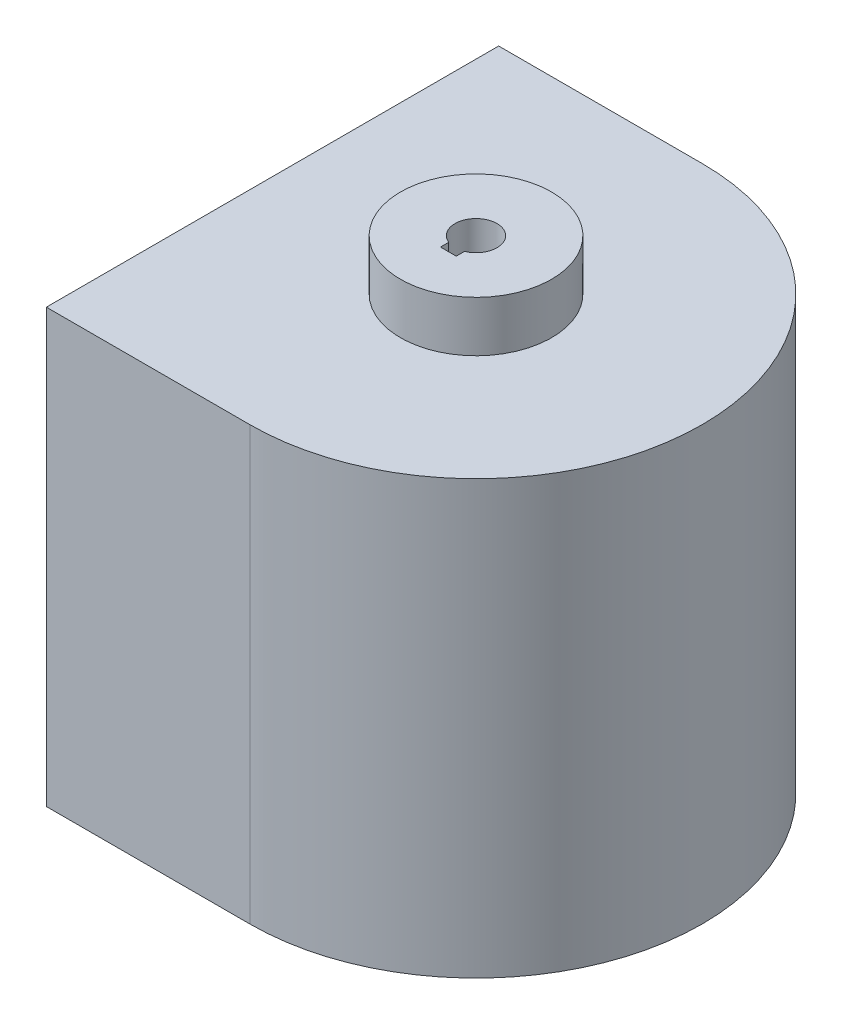
from build123d import *

# Parameters (mm, degrees)
BOSS_EXTRUDE1_DEPTH = 85
SKETCH2_R           = 14.86
BOSS_EXTRUDE2_DEPTH = 9.95
BOSS_EXTRUDE3_START = 9.95
SKETCH3_R           = 14.86
BOSS_EXTRUDE3_DEPTH = 9.95
CUT_EXTRUDE2_DEPTH  = 30


with BuildPart() as part:
    # Sketch1 → Boss-Extrude1 (new body)
    with BuildSketch(Plane(origin=(0, 0, 0), x_dir=(1, 0, 0), z_dir=(0, 1, 0))):
        with BuildLine():
            Line((0, 44.45), (-40, 44.45))
            Line((-40, 44.45), (-40, -44.45))
            Line((-40, -44.45), (0, -44.45))
            ThreePointArc((0, -44.45), (44.45, 0), (0, 44.45))
        make_face()
    extrude(amount=BOSS_EXTRUDE1_DEPTH)

    # Sketch2 → Boss-Extrude2 (add)
    with BuildSketch(Plane(origin=(0, 85, 0), x_dir=(1, 0, 0), z_dir=(0, 1, 0))):
        Circle(SKETCH2_R)
    extrude(amount=BOSS_EXTRUDE2_DEPTH)

    # Sketch3 → Boss-Extrude3 (add)
    with BuildSketch(Plane.XZ.offset(BOSS_EXTRUDE3_START)):
        Circle(SKETCH3_R)
    extrude(amount=-BOSS_EXTRUDE3_DEPTH)

    # Sketch6 → Cut-Extrude2 (cut)
    with BuildSketch(Plane(origin=(0, 94.95, 0), x_dir=(1, 0, 0), z_dir=(0, 1, 0))):
        with BuildLine():
            Line((1.55, -5.44), (1.55, -3.817315811))
            ThreePointArc((1.55, -3.817315811), (0, 4.12), (-1.55, -3.817315811))
            Line((-1.55, -3.817315811), (-1.55, -5.44))
            Line((-1.55, -5.44), (1.55, -5.44))
        make_face()
    extrude(amount=-CUT_EXTRUDE2_DEPTH, mode=Mode.SUBTRACT)


solid = part.part
